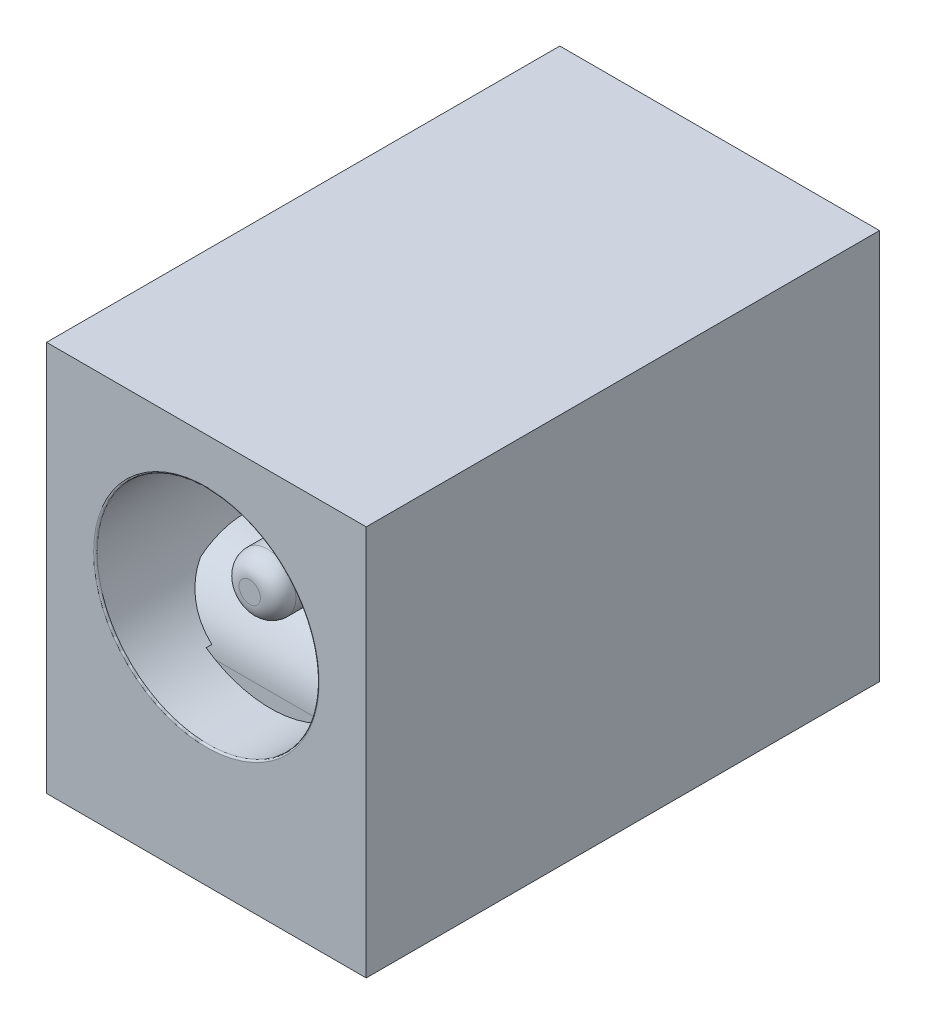
from build123d import *

# Parameters (mm, degrees)
ESBO_O1_W                     = 14.45
ESBO_O1_H                     = 11
RESSALTO_EXTRUS_O1_DEPTH      = 9
ESBO_O3_R                     = 3.125
CORTE_EXTRUS_O2_DEPTH         = 8.93
ESBO_O4_R                     = 0.8
RESSALTO_EXTRUS_O2_DEPTH      = 7.71
FILETE1_R                     = 0.5
FILETE2_R                     = 0.05
ESBO_O5_W                     = 6
ESBO_O5_H                     = 6
CORTE_EXTRUS_O5_DEPTH         = 4
RESSALTO_EXTRUS_O4_DEPTH      = 4
RESSALTO_EXTRUS_O4_DEPTH_BACK = 1.7
ESBO_O7_W                     = 5.688524138
ESBO_O7_H                     = 5.729720352
FILETE5_R                     = 2
CHANFRO4_SIZE                 = 2


with BuildPart() as part:
    # Esboço1 → Ressalto-extrusão1 (new body)
    with BuildSketch(Plane(origin=(0, 0, 0), x_dir=(0, 0, -1), z_dir=(1, 0, 0))):
        Rectangle(ESBO_O1_W, ESBO_O1_H)
    extrude(amount=RESSALTO_EXTRUS_O1_DEPTH)

    # Esboço3 → Corte-extrusão2 (cut)
    with BuildSketch(Plane.XY.offset(7.225)):
        with Locations((4.5, 1.05)):
            Circle(ESBO_O3_R)
    extrude(amount=-CORTE_EXTRUS_O2_DEPTH, mode=Mode.SUBTRACT)

    # Esboço4 → Ressalto-extrusão2 (add)
    with BuildSketch(Plane.XY.offset(-1.705)):
        with Locations(Location((4.5, 1.05, 0), (0, 0, 180))):
            Circle(ESBO_O4_R)
    extrude(amount=RESSALTO_EXTRUS_O2_DEPTH)

    # Filete1
    filete1_edges = [part.edges().sort_by_distance(p)[0] for p in [
        (5.3, 1.05, 6.005),
    ]]
    fillet(filete1_edges, radius=FILETE1_R)

    # Filete2
    filete2_edges = [part.edges().sort_by_distance(p)[0] for p in [
        (1.375, 1.05, 7.225),
    ]]
    fillet(filete2_edges, radius=FILETE2_R)

    # Esboço5 → Corte-extrusão5 (cut)
    with BuildSketch(Plane.XZ.offset(5.5)):
        with Locations((4.5, 2.425)):
            Rectangle(ESBO_O5_W, ESBO_O5_H)
    extrude(amount=-CORTE_EXTRUS_O5_DEPTH, mode=Mode.SUBTRACT)

    # Esboço7 → Ressalto-extrusão4 (add, two sides: drawn at the far end of the back side and taken through both)
    with BuildSketch(Plane.XZ.offset(1.5).offset(-RESSALTO_EXTRUS_O4_DEPTH_BACK)):
        with Locations((4.5, 2.425)):
            Rectangle(ESBO_O7_W, ESBO_O7_H)
    extrude(amount=RESSALTO_EXTRUS_O4_DEPTH + RESSALTO_EXTRUS_O4_DEPTH_BACK)

    # Filete5
    # the kernel refuses this fillet: 2 mm, written as the material it takes off along each edge
    with BuildSketch(Plane(origin=(12.344262069, 0.2, 5.289860176), x_dir=(0, -1, 0), z_dir=(-1, 0, 0))) as filete5_piece_1_section:
        with BuildLine():
            CenterArc((FILETE5_R, -FILETE5_R), FILETE5_R, 90, 90)
            Line((0, -FILETE5_R), (0, 0))
            Line((0, 0), (FILETE5_R, 0))
        make_face()
    filete5_piece_1 = extrude(amount=15.688524139, mode=Mode.PRIVATE)
    filete5_piece_1 = split(filete5_piece_1, bisect_by=Plane(origin=(6.764399642, -1.5, 5.283313475), z_dir=(0, -1, 0)), keep=Keep.TOP, mode=Mode.PRIVATE)
    filete5_piece_1 = split(filete5_piece_1, bisect_by=Plane(origin=(1.5, -1.579624939, 5.283313475), z_dir=(1, 0, 0)), keep=Keep.TOP, mode=Mode.PRIVATE)
    filete5_piece_1 = split(filete5_piece_1, bisect_by=Plane(origin=(7.5, -1.579624939, 5.283313475), z_dir=(-1, 0, 0)), keep=Keep.TOP, mode=Mode.PRIVATE)
    add(filete5_piece_1, mode=Mode.SUBTRACT)
    with BuildSketch(Plane(origin=(12.344262069, 0.2, 5.289860176), x_dir=(0, -1, 0), z_dir=(-1, 0, 0))) as filete5_piece_2_section:
        with BuildLine():
            CenterArc((FILETE5_R, -FILETE5_R), FILETE5_R, 90, 90)
            Line((0, -FILETE5_R), (0, 0))
            Line((0, 0), (FILETE5_R, 0))
        make_face()
    filete5_piece_2 = extrude(amount=15.688524139, mode=Mode.PRIVATE)
    filete5_piece_2 = filete5_piece_2 & Plane(origin=(4.5, 1.05, 4.831537274), x_dir=(1, 0, 0), z_dir=(0, 0, 1)) * Cylinder(3.125, 40, mode=Mode.PRIVATE)
    add(filete5_piece_2, mode=Mode.SUBTRACT)

    # Chanfro4
    # the kernel refuses this chamfer: 2 mm, written as the material it takes off along each edge
    with BuildSketch(Plane(origin=(-3.487628045, 0.2, -0.439860176), x_dir=(0, 0.02749587661058638, 0.9996219169112968), z_dir=(1, 0, 0))) as chanfro4_piece_1_section:
        Polygon((CHANFRO4_SIZE * 0.999621916911, CHANFRO4_SIZE * 0.0274958766106), (-CHANFRO4_SIZE * 0.0274958766106, CHANFRO4_SIZE * 0.999621916911), (0, 0), align=None)
    chanfro4_piece_1 = extrude(amount=15.975256091, mode=Mode.PRIVATE)
    chanfro4_piece_1 = split(chanfro4_piece_1, bisect_by=Plane(origin=(2.25835967, -1.5, -0.343331673), z_dir=(0, -1, 0)), keep=Keep.TOP, mode=Mode.PRIVATE)
    chanfro4_piece_1 = split(chanfro4_piece_1, bisect_by=Plane(origin=(7.5, -1.606942994, -0.343331673), z_dir=(-1, 0, 0)), keep=Keep.TOP, mode=Mode.PRIVATE)
    chanfro4_piece_1 = split(chanfro4_piece_1, bisect_by=Plane(origin=(1.5, -1.606942994, -0.343331673), z_dir=(1, 0, 0)), keep=Keep.TOP, mode=Mode.PRIVATE)
    add(chanfro4_piece_1, mode=Mode.SUBTRACT)
    with BuildSketch(Plane(origin=(-3.487628045, 0.2, -0.439860176), x_dir=(0, 0.02749587661058638, 0.9996219169112968), z_dir=(1, 0, 0))) as chanfro4_piece_2_section:
        Polygon((CHANFRO4_SIZE * 0.999621916911, CHANFRO4_SIZE * 0.0274958766106), (-CHANFRO4_SIZE * 0.0274958766106, CHANFRO4_SIZE * 0.999621916911), (0, 0), align=None)
    chanfro4_piece_2 = extrude(amount=15.975256091, mode=Mode.PRIVATE)
    chanfro4_piece_2 = chanfro4_piece_2 & Plane(origin=(4.5, 1.05, 0.259438948), x_dir=(1, 0, 0), z_dir=(0, 0, 1)) * Cylinder(3.125, 40, mode=Mode.PRIVATE)
    add(chanfro4_piece_2, mode=Mode.SUBTRACT)


solid = part.part
